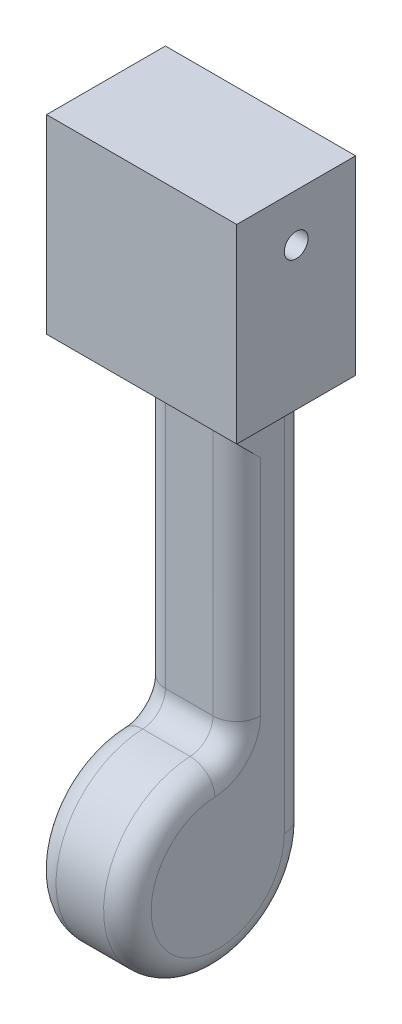
from build123d import *

# Parameters (mm, degrees)
BOSS_EXTRUDE2_DEPTH = 10
SKETCH1_5_R         = 2.5
BOSS_EXTRUDE3_DEPTH = 20
CHAMFER1_SIZE       = 10
FILLET1_R           = 5


with BuildPart() as part:
    # Sketch1 → Boss-Extrude2 (new, symmetric)
    with BuildSketch(Plane(origin=(0, 0, 0), x_dir=(0, 0, -1), z_dir=(1, 0, 0))):
        with BuildLine():
            Line((-2.5, -20), (-2.5, -87.425824379))
            ThreePointArc((-2.5, -87.425824379), (-21.281745499, -117.937336386), (12.5, -106))
            Line((12.5, -106), (12.5, -20))
            Line((12.5, -20), (-2.5, -20))
        make_face()
    extrude(amount=BOSS_EXTRUDE2_DEPTH, both=True)

    # Sketch1<5> → Boss-Extrude3 (add, symmetric)
    with BuildSketch(Plane(origin=(0, 0, 0), x_dir=(0, 0, -1), z_dir=(1, 0, 0))):
        Polygon((12.5, -20), (-2.5, -20), (-12.5, -20), (-12.5, 20), (12.5, 20), align=None)
        with Locations((0, 10)):
            Circle(SKETCH1_5_R, mode=Mode.SUBTRACT)
    extrude(amount=BOSS_EXTRUDE3_DEPTH, both=True)

    # Chamfer1
    chamfer1_edges = [part.edges().sort_by_distance(p)[0] for p in [
        (0, -20, 2.5),
    ]]
    chamfer(chamfer1_edges, length=CHAMFER1_SIZE - 0.0001)  # a hair under: the kernel refuses the full size

    # Fillet1
    fillet1_edges = [part.edges().sort_by_distance(p)[0] for p in [
        (10, -117.937336386, 21.281745499),
        (10, -63, -12.5),
        (-10, -58.712862189, 2.5),
        (10, -58.712862189, 2.5),
        (-10, -63, -12.5),
        (-10, -117.937336386, 21.281745499),
        (0, -87.425824379, 2.5),
    ]]
    fillet(fillet1_edges, radius=FILLET1_R)


solid = part.part
